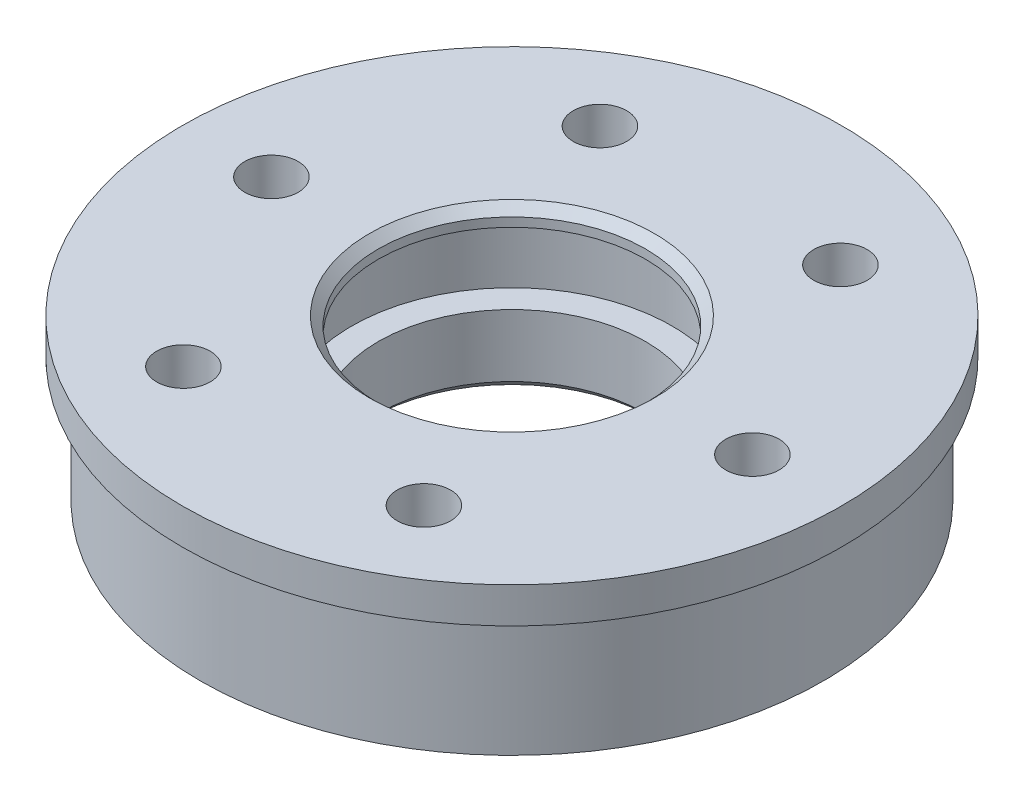
from build123d import *

# Parameters (mm, degrees)
SKETCH1_R           = 17.5
SKETCH1_R_2         = 1.5
SKETCH1_R_3         = 7.5
BOSS_EXTRUDE1_DEPTH = 4.5
CUT_EXTRUDE1_START  = -0.5
SKETCH2_R           = 9
CUT_EXTRUDE1_DEPTH  = 4
SKETCH3_R           = 15
SKETCH3_R_2         = 12
BOSS_EXTRUDE2_DEPTH = 1.5
CHAMFER1_SIZE       = 0.5
SKETCH4_R           = 18.5
SKETCH4_R_2         = 17.5
BOSS_EXTRUDE3_DEPTH = 2
SKETCH5_R           = 2.35
CUT_EXTRUDE2_DEPTH  = 4


with BuildPart() as part:
    # Sketch1 → Boss-Extrude1 (new, symmetric)
    with BuildSketch(Plane(origin=(0, 0, 0), x_dir=(1, 0, 0), z_dir=(0, 1, 0))):
        Circle(SKETCH1_R)
        with Locations((13.5, 0)):
            Circle(SKETCH1_R_2, mode=Mode.SUBTRACT)
        with Locations((6.75, -11.691342951)):
            Circle(SKETCH1_R_2, mode=Mode.SUBTRACT)
        with Locations((-6.75, -11.691342951)):
            Circle(SKETCH1_R_2, mode=Mode.SUBTRACT)
        with Locations((-13.5, 0)):
            Circle(SKETCH1_R_2, mode=Mode.SUBTRACT)
        with Locations((-6.75, 11.691342951)):
            Circle(SKETCH1_R_2, mode=Mode.SUBTRACT)
        with Locations((6.75, 11.691342951)):
            Circle(SKETCH1_R_2, mode=Mode.SUBTRACT)
        Circle(SKETCH1_R_3, mode=Mode.SUBTRACT)
    extrude(amount=BOSS_EXTRUDE1_DEPTH, both=True)

    # Sketch2 → Cut-Extrude1 (cut)
    with BuildSketch(Plane(origin=(0, 0, 0), x_dir=(1, 0, 0), z_dir=(0, 1, 0)).offset(CUT_EXTRUDE1_START)):
        Circle(SKETCH2_R)
    extrude(amount=CUT_EXTRUDE1_DEPTH, mode=Mode.SUBTRACT)

    # Sketch3 → Boss-Extrude2 (add)
    with BuildSketch(Plane.XZ.offset(4.5)):
        Circle(SKETCH3_R)
        Circle(SKETCH3_R_2, mode=Mode.SUBTRACT)
    extrude(amount=-BOSS_EXTRUDE2_DEPTH)

    # Chamfer1
    chamfer1_edges = [part.edges().sort_by_distance(p)[0] for p in [
        (-7.5, -4.5, 0),
        (-7.5, 4.5, 0),
    ]]
    chamfer(chamfer1_edges, length=CHAMFER1_SIZE)

    # Sketch4 → Boss-Extrude3 (add)
    with BuildSketch(Plane(origin=(0, 4.5, 0), x_dir=(1, 0, 0), z_dir=(0, 1, 0))):
        Circle(SKETCH4_R)
        Circle(SKETCH4_R_2, mode=Mode.SUBTRACT)
    extrude(amount=-BOSS_EXTRUDE3_DEPTH)

    # Sketch5 → Cut-Extrude2 (cut)
    with BuildSketch(Plane(origin=(0, -4.5, 0), x_dir=(-1, 0, 0), z_dir=(0, -1, 0))):
        with Locations((-10.825317547, -6.25)):
            Circle(SKETCH5_R)
        with Locations((-10.825317547, 6.25)):
            Circle(SKETCH5_R)
        with Locations((0, 12.5)):
            Circle(SKETCH5_R)
        with Locations((10.825317547, 6.25)):
            Circle(SKETCH5_R)
        with Locations((10.825317547, -6.25)):
            Circle(SKETCH5_R)
        with Locations((0, -12.5)):
            Circle(SKETCH5_R)
    extrude(amount=-CUT_EXTRUDE2_DEPTH, mode=Mode.SUBTRACT)


solid = part.part
